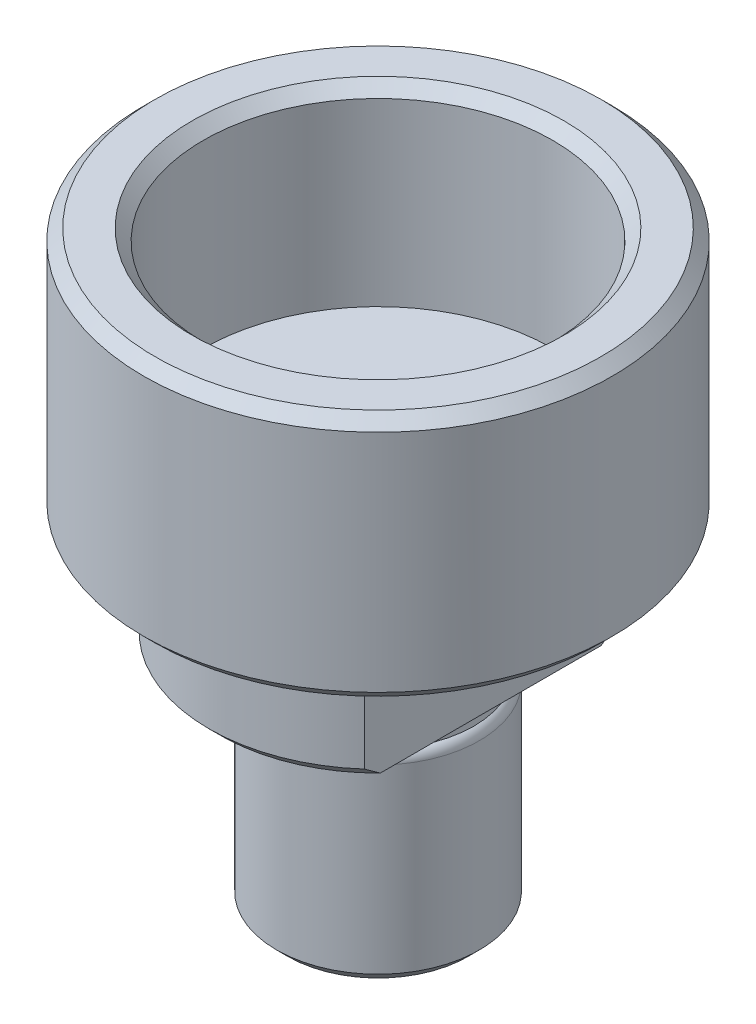
from build123d import *

# Parameters (mm, degrees)
CHAFL_N1_SIZE         = 1
REDONDEO1_R           = 1
CHAFL_N2_SIZE         = 1
CROQUIS3_W            = 14.730869345
CROQUIS3_H            = 22.360679774
CORTAR_EXTRUIR1_DEPTH = 30


with BuildPart() as part:
    # Croquis1 → Revolución1 (revolve)
    with BuildSketch(Plane.XY, mode=Mode.PRIVATE) as revoluci_n1_sk:
        Polygon((15.5, 52), (20.790206312, 52), (20.790206312, 30), (15, 30), (15, 20), (8.5, 20), (8.5, 17.951688966), (9, 17.951688966), (9, 0), (4.7625, 0), (4.7625, 30), (4.2625, 30), (4.2625, 34), (5.2625, 35), (15.5, 35), align=None)
    revolve(revoluci_n1_sk.sketch.rotate(Axis((0, 50.374990084, 0), (0, -1, 0)), 90), axis=Axis((0, 50.374990084, 0), (0, -1, 0)))

    # Chaflán1
    chafl_n1_edges = [part.edges().sort_by_distance(p)[0] for p in [
        (0, 0, -9),
    ]]
    chamfer(chafl_n1_edges, length=CHAFL_N1_SIZE)

    # Redondeo1
    # the kernel refuses this fillet: 1 mm, written as the material it takes off along each edge
    with BuildSketch(Plane(origin=(0, 17.951688966, 0), x_dir=(0, 0, 1), z_dir=(1, 0, 0))) as redondeo1_piece_1:
        with BuildLine():
            CenterArc((8, 0.866025404), REDONDEO1_R, 300, 60)
            Line((8.5, 0), (8.51, -0.017320508))
            ThreePointArc((8.51, -0.017320508), (8.75, -0.02), (9, -0.02))
            Line((9, -0.02), (9.02, 0))
            Line((9.02, 0), (9.02, 0.866025404))
            Line((9.02, 0.866025404), (9, 0.866025404))
        make_face()
    revolve(axis=Axis((0, 17.951688966, 0), (0, -1, 0)), mode=Mode.SUBTRACT)

    # Chaflán2
    chafl_n2_edges = [part.edges().sort_by_distance(p)[0] for p in [
        (0, 20, -15),
        (0, 30, -20.790206312),
        (0, 52, -20.790206312),
        (0, 52, -15.5),
    ]]
    chamfer(chafl_n2_edges, length=CHAFL_N2_SIZE)

    # Croquis3 → Cortar-Extruir1 (cut)
    with BuildSketch(Plane.XZ):
        Polygon((10, 11.180339887), (10, -11.180339887), (24.245950338, -11.180339887), (24.827853146, 11.180339887), align=None)
        with Locations((-17.365434673, 0)):
            Rectangle(CROQUIS3_W, CROQUIS3_H)
    extrude(amount=-CORTAR_EXTRUIR1_DEPTH, mode=Mode.SUBTRACT)


solid = part.part
